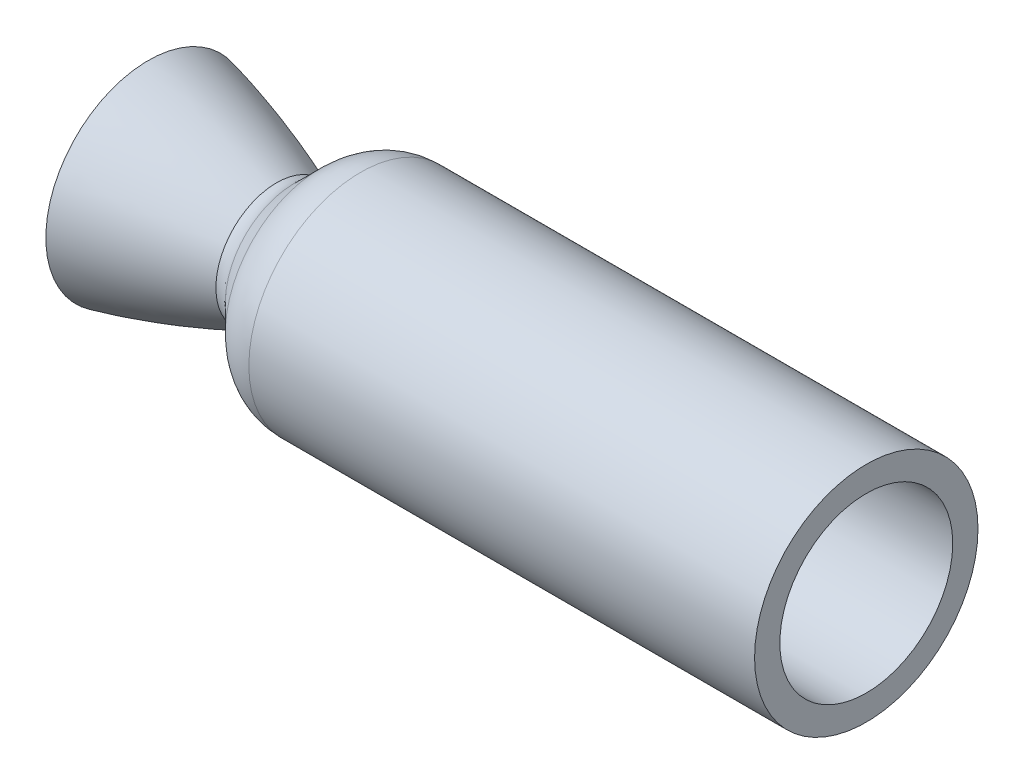
from build123d import *


with BuildPart() as part:
    # Sketch1 → Revolve1 (revolve)
    with BuildSketch(Plane.XY):
        with BuildLine():
            Line((28.949236933, 27.386004017), (189.133015331, 27.386004017))
            Line((189.133015331, 27.386004017), (189.133015331, 35.386004017))
            Line((189.133015331, 35.386004017), (28.949236933, 35.386004017))
            ThreePointArc((28.949236933, 35.386004017), (22.060935151, 34.015835602), (16.221314872, 30.113926078))
            Line((16.221314872, 30.113926078), (7.884849119, 21.777460326))
            ThreePointArc((7.884849119, 21.777460326), (5.344435892, 20.007381854), (2.348184674, 19.226769399))
            add(Edge.make_bspline(
                [(2.348184674, 19.226769399), (-17.827706836, 27.665327765), (-38.315022829, 32.432092239)],
                knots=[0.018493807, 0.018493807, 0.018493807, 1, 1, 1], degree=2))
            Line((-38.315022829, 32.432092239), (-40.127010283, 24.64))
            add(Edge.make_bspline(
                [(0, 11.536137468), (-19.948257354, 19.947595697), (-40.127010283, 24.64)],
                knots=[0, 0, 0, 1, 1, 1], degree=2))
            ThreePointArc((0, 11.536137468), (0.81433228, 11.284876268), (1.662309445, 11.2))
            ThreePointArc((1.662309445, 11.2), (8.091391109, 12.478823854), (13.541703369, 16.120606076))
            Line((13.541703369, 16.120606076), (21.878169121, 24.457071829))
            ThreePointArc((21.878169121, 24.457071829), (25.12240261, 26.624799342), (28.949236933, 27.386004017))
        make_face()
    revolve(axis=Axis((0, 0, 0), (-1, 0, 0)))


solid = part.part
